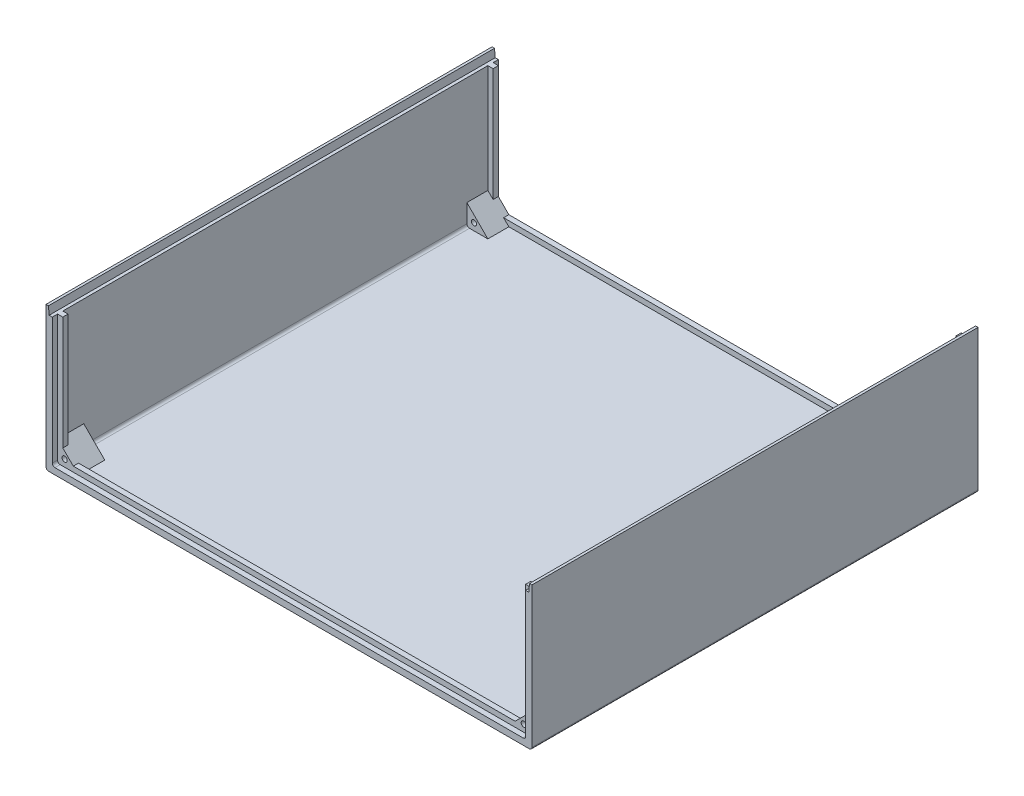
from build123d import *

# Parameters (mm, degrees)
EXTRUDE_1_DEPTH = 170
EXTRUDE_START   = 2
SKETCH_1_3_R    = 1
EXTRUDE_2_DEPTH = 10
EXTRUDE_3_DEPTH = 2
FILLET_1_R      = 1
EXTRUDE_START_2 = 158
SKETCH_1_5_R    = 1
EXTRUDE_4_DEPTH = 10
EXTRUDE_START_3 = 166
EXTRUDE_5_DEPTH = 2
FILLET_2_R      = 1
SKETCH_2_W      = 1.2
SKETCH_2_H      = 170
EXTRUDE_6_DEPTH = 3
CHAMFER_1_SIZE2 = 3
CHAMFER_1_SIZE  = 0.262465991
CHAMFER_2_SIZE2 = 0.262465991
CHAMFER_2_SIZE  = 3
FILLET_3_R      = 1


with BuildPart() as part:
    # Эскиз1 → Бобышка-Вытянуть1 (new body)
    with BuildSketch(Plane.XY):
        Polygon((0, 49.2), (-2.4, 49.2), (-2.4, -2.4), (182.8, -2.4), (182.8, 49.2), (180.4, 49.2), (180.4, 0), (0, 0), align=None)
    extrude(amount=EXTRUDE_1_DEPTH)

    # Эскиз1<3> → Бобышка-Вытянуть2 (add)
    # profile 1 of 2: a face of its own
    with BuildSketch(Plane.XY.offset(EXTRUDE_START)):
        Polygon((2, 6), (0, 8), (0, 0), (8, 0), (6, 2), align=None)
        with Locations((2.7, 2.7)):
            Circle(SKETCH_1_3_R, mode=Mode.SUBTRACT)
    # profile 2 of 2: a face of its own
    with BuildSketch(Plane.XY.offset(EXTRUDE_START)):
        Polygon((174.4, 2), (172.4, 0), (180.4, 0), (180.4, 8), (178.4, 6), align=None)
        with Locations((177.7, 2.7)):
            Circle(SKETCH_1_3_R, mode=Mode.SUBTRACT)
    extrude(amount=EXTRUDE_2_DEPTH)

    # Эскиз1<4> → Бобышка-Вытянуть3 (add)
    with BuildSketch(Plane.XY.offset(EXTRUDE_START)):
        Polygon((178.4, 49.2), (178.4, 6), (180.4, 8), (180.4, 49.2), align=None)
        Polygon((6, 2), (8, 0), (172.4, 0), (174.4, 2), align=None)
        Polygon((2, 49.2), (0, 49.2), (0, 8), (2, 6), align=None)
    extrude(amount=EXTRUDE_3_DEPTH)

    # Скругление1
    fillet_1_edges = [part.edges().sort_by_distance(p)[0] for p in [
        (182.8, -2.4, 85),
        (-2.4, -2.4, 85),
        (0, 0, 1),
        (180.4, 0, 1),
    ]]
    fillet(fillet_1_edges, radius=FILLET_1_R)

    # Эскиз1<5> → Бобышка-Вытянуть4 (add)
    # profile 1 of 2: a face of its own
    with BuildSketch(Plane.XY.offset(EXTRUDE_START_2)):
        Polygon((174.4, 2), (172.4, 0), (180.4, 0), (180.4, 8), (178.4, 6), align=None)
        with Locations((177.7, 2.7)):
            Circle(SKETCH_1_5_R, mode=Mode.SUBTRACT)
    # profile 2 of 2: a face of its own
    with BuildSketch(Plane.XY.offset(EXTRUDE_START_2)):
        Polygon((2, 6), (0, 8), (0, 0), (8, 0), (6, 2), align=None)
        with Locations((2.7, 2.7)):
            Circle(SKETCH_1_5_R, mode=Mode.SUBTRACT)
    extrude(amount=EXTRUDE_4_DEPTH)

    # Эскиз1<6> → Бобышка-Вытянуть5 (add)
    with BuildSketch(Plane.XY.offset(EXTRUDE_START_3)):
        Polygon((178.4, 49.2), (178.4, 6), (180.4, 8), (180.4, 49.2), align=None)
        Polygon((6, 2), (8, 0), (172.4, 0), (174.4, 2), align=None)
        Polygon((2, 49.2), (0, 49.2), (0, 8), (2, 6), align=None)
    extrude(amount=EXTRUDE_5_DEPTH)

    # Скругление2
    fillet_2_edges = [part.edges().sort_by_distance(p)[0] for p in [
        (180.4, 0, 85),
        (0, 0, 85),
    ]]
    fillet(fillet_2_edges, radius=FILLET_2_R)

    # Эскиз2 → Бобышка-Вытянуть6 (add)
    with BuildSketch(Plane(origin=(0, 49.2, 0), x_dir=(1, 0, 0), z_dir=(0, 1, 0))):
        with Locations((-1.8, -85)):
            Rectangle(SKETCH_2_W, SKETCH_2_H)
        with Locations((182.2, -85)):
            Rectangle(SKETCH_2_W, SKETCH_2_H)
    extrude(amount=EXTRUDE_6_DEPTH)

    # Фаска1
    chamfer_1_edges = [part.edges().sort_by_distance(p)[0] for p in [
        (-1.2, 52.2, 85),
    ]]
    chamfer_1_side = [part.faces().sort_by_distance(p)[0] for p in [
        (-1.20524932, 52.2, 85),
    ]]
    chamfer(chamfer_1_edges, length=CHAMFER_1_SIZE - 0.0001, length2=CHAMFER_1_SIZE2 - 0.0001, reference=chamfer_1_side[0])  # a hair under: the kernel refuses the full size

    # Фаска2
    chamfer_2_edges = [part.edges().sort_by_distance(p)[0] for p in [
        (181.6, 52.2, 85),
    ]]
    chamfer_2_side = [part.faces().sort_by_distance(p)[0] for p in [
        (181.6, 52.19475068, 85),
    ]]
    chamfer(chamfer_2_edges, length=CHAMFER_2_SIZE - 0.0001, length2=CHAMFER_2_SIZE2 - 0.0001, reference=chamfer_2_side[0])  # a hair under: the kernel refuses the full size

    # Скругление3
    fillet_3_edges = [part.edges().sort_by_distance(p)[0] for p in [
        (0, 0, 169),
        (180.4, 0, 169),
    ]]
    fillet(fillet_3_edges, radius=FILLET_3_R)


solid = part.part
